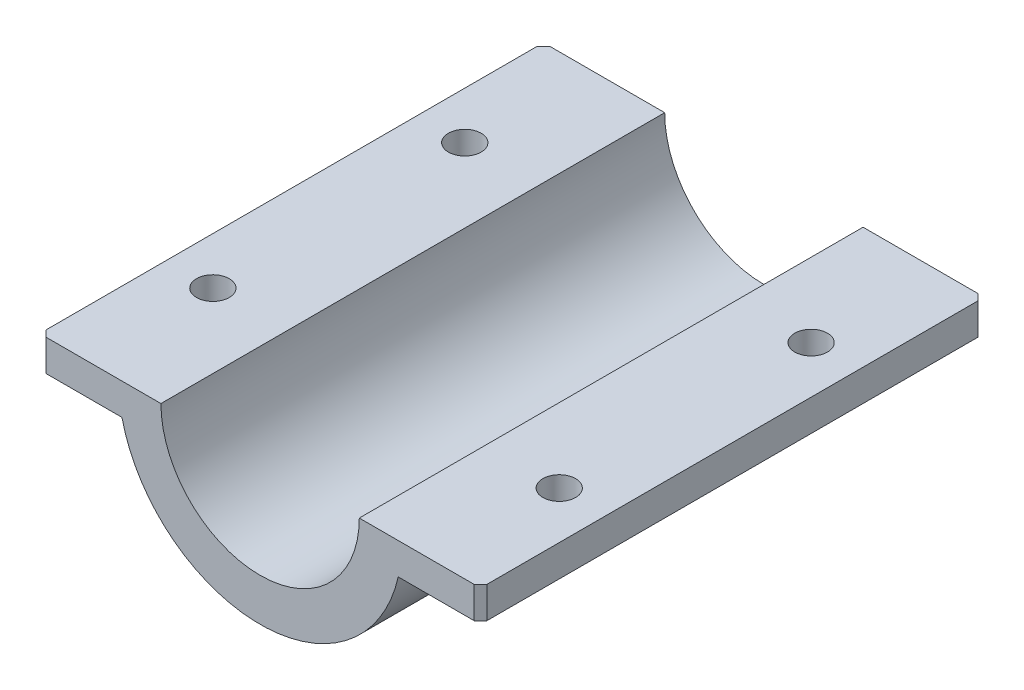
from build123d import *

# Parameters (mm, degrees)
EXTRUDE_1_DEPTH     = 40
SKETCH_2_R          = 2.6
CUT_EXTRUDE_1_DEPTH = 10
CHAMFER_1_SIZE      = 1


with BuildPart() as part:
    # 草图1 → 凸台-拉伸1 (new, symmetric)
    with BuildSketch(Plane.XY):
        with BuildLine():
            Line((35, 0), (15.75, 0))
            ThreePointArc((15.75, 0), (0, -15.75), (-15.75, 0))
            Line((-15.75, 0), (-35, 0))
            Line((-35, 0), (-35, -5))
            Line((-35, -5), (-21.937410968, -5))
            ThreePointArc((-21.937410968, -5), (0, -22.5), (21.937410968, -5))
            Line((21.937410968, -5), (35, -5))
            Line((35, -5), (35, 0))
        make_face()
    extrude(amount=EXTRUDE_1_DEPTH, both=True)

    # 草图2 → 切除-拉伸1 (cut)
    with BuildSketch(Plane(origin=(0, -5, 0), x_dir=(-1, 0, 0), z_dir=(0, -1, 0))):
        with Locations((27.5, -20)):
            Circle(SKETCH_2_R)
        with Locations((27.5, 20)):
            Circle(SKETCH_2_R)
        with Locations((-27.5, -20)):
            Circle(SKETCH_2_R)
        with Locations((-27.5, 20)):
            Circle(SKETCH_2_R)
    extrude(amount=-CUT_EXTRUDE_1_DEPTH, mode=Mode.SUBTRACT)

    # 倒角1
    chamfer_1_edges = [part.edges().sort_by_distance(p)[0] for p in [
        (-35, -2.5, -40),
        (35, -2.5, -40),
        (35, -2.5, 40),
        (-35, -2.5, 40),
    ]]
    chamfer(chamfer_1_edges, length=CHAMFER_1_SIZE)


solid = part.part
